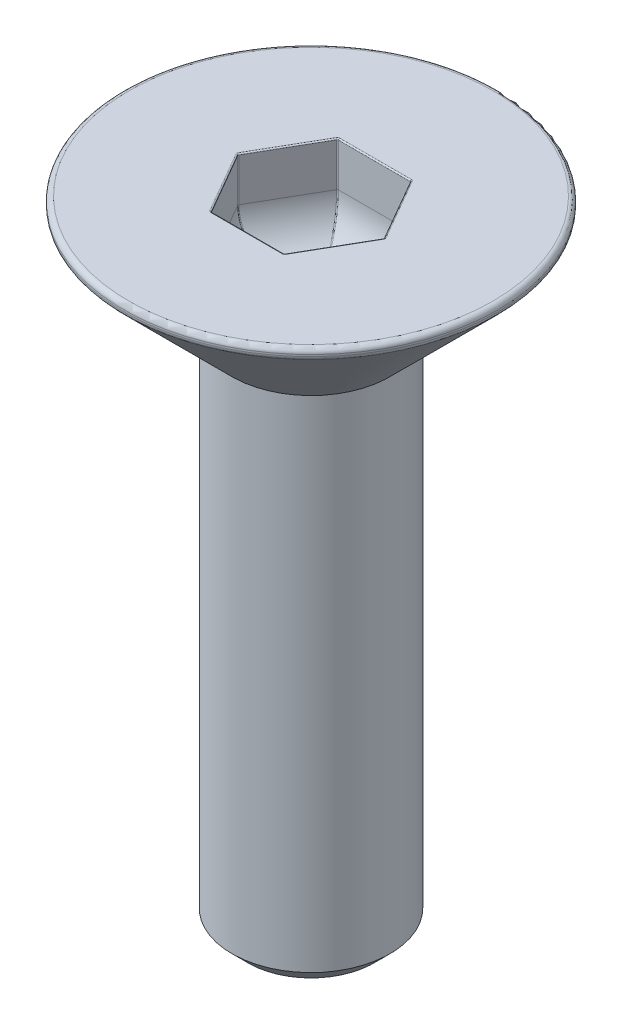
from build123d import *

# Parameters (mm, degrees)
SKETCH8_W          = 1.25
SKETCH8_H          = 10
CHAMFER1_SIZE      = 0.25
CHAMFER2_SIZE      = 0.2
CHAMFER2_SIZE2     = 0.141421356
FILLET1_R          = 0.08
CUT_EXTRUDE1_DEPTH = 1.5
FILLET2_R          = 0.8
FILLET5_R          = 0.02


with BuildPart() as part:
    # Sketch8 → Revolve1 (revolve)
    with BuildSketch(Plane.XY):
        with Locations((0.625, -5)):
            Rectangle(SKETCH8_W, SKETCH8_H)
    revolve(axis=Axis((0, 0, 0), (0, -1, 0)))

    # Chamfer1
    chamfer1_edges = [part.edges().sort_by_distance(p)[0] for p in [
        (-1.25, -10, 0),
    ]]
    chamfer(chamfer1_edges, length=CHAMFER1_SIZE)

    # Sketch13 → Revolve2 (revolve)
    with BuildSketch(Plane.XY):
        Polygon((0, 0), (3.1, 0), (0, -3.1), align=None)
    revolve(axis=Axis((0, 0, 0), (0, -1, 0)))

    # Chamfer2
    chamfer2_edges = [part.edges().sort_by_distance(p)[0] for p in [
        (-3.1, 0, 0),
    ]]
    chamfer2_side = [part.faces().sort_by_distance(p)[0] for p in [
        (-2.175, -0.925, 0),
    ]]
    chamfer(chamfer2_edges, length=CHAMFER2_SIZE, length2=CHAMFER2_SIZE2, reference=chamfer2_side[0])

    # Fillet1
    fillet1_edges = [part.edges().sort_by_distance(p)[0] for p in [
        (-2.958578644, 0, 0),
        (-2.958578644, -0.141421356, 0),
    ]]
    fillet(fillet1_edges, radius=FILLET1_R)

    # Sketch14 → Cut-Extrude1 (cut)
    with BuildSketch(Plane(origin=(0, 0, 0), x_dir=(1, 0, 0), z_dir=(0, 1, 0))):
        Polygon((1.154700538, 0), (0.577350269, 1), (-0.577350269, 1), (-1.154700538, 0), (-0.577350269, -1), (0.577350269, -1), align=None)
    extrude(amount=-CUT_EXTRUDE1_DEPTH, mode=Mode.SUBTRACT)

    # Fillet2
    fillet2_edges = [part.edges().sort_by_distance(p)[0] for p in [
        (0, -1.5, 1),
        (-0.866025404, -1.5, 0.5),
        (-0.866025404, -1.5, -0.5),
        (0, -1.5, -1),
        (0.866025404, -1.5, -0.5),
        (0.866025404, -1.5, 0.5),
    ]]
    fillet(fillet2_edges, radius=FILLET2_R)

    # Fillet5
    fillet5_edges = [part.edges().sort_by_distance(p)[0] for p in [
        (0, 0, -1),
        (-0.8660254037844393, 0, -0.5000000000000002),
        (-0.8660254037844393, 0, 0.5000000000000006),
        (0, 0, 1),
        (0.8660254037844394, 0, 0.5000000000000003),
        (0.8660254037844393, 0, -0.5000000000000006),
        (-0.860417326, -1.285507322, 0),
        (-0.430208663, -1.285507322, 0.745143262),
        (0.430208663, -1.285507322, 0.745143262),
        (0.860417326, -1.285507322, 0),
        (0.430208663, -1.285507322, -0.745143262),
        (-0.430208663, -1.285507322, -0.745143262),
        (-1.154700538, -0.35, 0),
        (-0.577350269, -0.35, 1),
        (0.577350269, -0.35, 1),
        (1.154700538, -0.35, 0),
        (0.577350269, -0.35, -1),
        (-0.577350269, -0.35, -1),
    ]]
    fillet(fillet5_edges, radius=FILLET5_R)


solid = part.part
